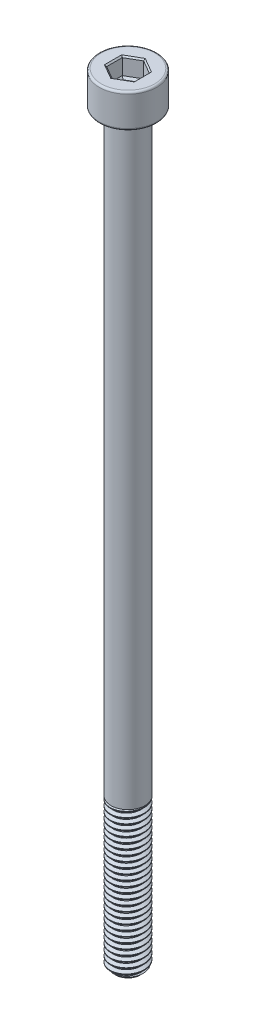
from build123d import *

# Parameters (mm, degrees)
SKETCH1_R           = 2.5
BOSS_EXTRUDE1_DEPTH = 22
THREAD1_PITCH       = 0.8
SKETCH2_R           = 2.5
BOSS_EXTRUDE2_DEPTH = 88
SKETCH3_R           = 4.25
BOSS_EXTRUDE3_DEPTH = 5
FILLET1_R           = 0.3
CUT_EXTRUDE1_DEPTH  = 2.5
CHAMFER1_SIZE       = 0.2
CUT_EXTRUDE2_DEPTH  = 0.3
CUT_EXTRUDE2_DRAFT  = -45


with BuildPart() as part:
    # Sketch1 → Boss-Extrude1 (new body)
    with BuildSketch(Plane(origin=(0, 0, 0), x_dir=(1, 0, 0), z_dir=(0, 1, 0))):
        with Locations(Location((0, 0, 0), (0, 0, 270))):
            Circle(SKETCH1_R)
    extrude(amount=BOSS_EXTRUDE1_DEPTH)

    # Thread1: arcs per turn and ends read off the stored shape
    # Thread1: the profile of Thread Profile1 profile screwed along a right-hand helix through 30 turns, 8 arcs to a turn; built about Z, then put on its axis
    thread1_z = Axis((0, 0, 0), (0, 0, 1))
    thread1_corners = [(2.5003, 0, -0.000173205), (2.5003, 0, 0.700173203), (2.0669873, 0, 0.449999999), (2.0669873, 0, 0.249999999)]
    with BuildLine(mode=Mode.PRIVATE) as thread1_profile:
        Line(thread1_corners[0], thread1_corners[1])
        Line(thread1_corners[1], thread1_corners[2])
        Line(thread1_corners[2], thread1_corners[3])
        Line(thread1_corners[3], thread1_corners[0])
    thread1_cap = Face(thread1_profile.wire())
    thread1_turn_angles = [0, 22.5, 45, 67.5, 90, 112.5, 135, 157.5, 180, 202.5, 225, 247.5, 270, 292.5, 315, 337.5, 360]
    thread1_turn_weights = [1, 0.9238795325112867, 1, 0.9238795325112867, 1, 0.9238795325112867, 1, 0.9238795325112867, 1, 0.9238795325112867, 1, 0.9238795325112867, 1, 0.9238795325112867, 1, 0.9238795325112867, 1]
    thread1_turn_rails = [Edge.make_bspline([Vector(p[0], p[1], 0).rotate(thread1_z, thread1_turn_angles[k]) / thread1_turn_weights[k] + Vector(0, 0, p[2] + THREAD1_PITCH * thread1_turn_angles[k] / 360) for k in range(17)], [0, 0, 0, 1, 1, 2, 2, 3, 3, 4, 4, 5, 5, 6, 6, 7, 7, 8, 8, 8], 2, thread1_turn_weights) for p in thread1_corners]
    thread1_turn_sides = [Face.make_surface_from_curves(thread1_turn_rails[p[0]], thread1_turn_rails[p[1]]) for p in [(0, 1), (1, 2), (2, 3), (3, 0)]]
    thread1 = Plane(origin=(0, 23, 0), x_dir=(-1, 0, 0), z_dir=(0, -1, 0)) * Solid(Shell([*[p.moved(Location((0, 0, THREAD1_PITCH * i))) for i in range(30) for p in thread1_turn_sides], thread1_cap, thread1_cap.rotate(thread1_z, 10800).moved(Location((0, 0, THREAD1_PITCH * 10800 / 360)))]))
    add(thread1, mode=Mode.SUBTRACT)

    # Sketch2 → Boss-Extrude2 (add)
    with BuildSketch(Plane(origin=(0, 22, 0), x_dir=(1, 0, 0), z_dir=(0, 1, 0))):
        with Locations(Location((0, 0, 0), (0, 0, 90))):
            Circle(SKETCH2_R)
    extrude(amount=BOSS_EXTRUDE2_DEPTH)

    # Sketch3 → Boss-Extrude3 (add)
    with BuildSketch(Plane(origin=(0, 110, 0), x_dir=(1, 0, 0), z_dir=(0, 1, 0))):
        with Locations(Location((0, 0, 0), (0, 0, 270))):
            Circle(SKETCH3_R)
    extrude(amount=BOSS_EXTRUDE3_DEPTH)

    # Fillet1
    fillet1_edges = [part.edges().sort_by_distance(p)[0] for p in [
        (0, 110, -4.25),
        (0, 115, -4.25),
    ]]
    fillet(fillet1_edges, radius=FILLET1_R)

    # Sketch4 → Cut-Revolve1 (revolve, cut)
    with BuildSketch(Plane.XY, mode=Mode.PRIVATE) as cut_revolve1_sk:
        Polygon((2.51, 0), (2.51, 0.7), (1.81, 0), align=None)
    revolve(cut_revolve1_sk.sketch.rotate(Axis((0, 0, 0), (0, 1, 0)), 90), axis=Axis((0, 0, 0), (0, 1, 0)), mode=Mode.SUBTRACT)

    # Sketch5 → Cut-Extrude1 (cut)
    with BuildSketch(Plane(origin=(0, 115, 0), x_dir=(1, 0, 0), z_dir=(0, 1, 0))):
        Polygon((0, 2.309401077), (-2, 1.154700538), (-2, -1.154700538), (0, -2.309401077), (2, -1.154700538), (2, 1.154700538), align=None)
    extrude(amount=-CUT_EXTRUDE1_DEPTH, mode=Mode.SUBTRACT)

    # Chamfer1
    chamfer1_edges = [part.edges().sort_by_distance(p)[0] for p in [
        (1, 115, -1.732050808),
        (-1, 115, -1.732050808),
        (-2, 115, 0),
        (-1, 115, 1.732050808),
        (1, 115, 1.732050808),
        (2, 115, 0),
    ]]
    chamfer(chamfer1_edges, length=CHAMFER1_SIZE)


with BuildPart() as cut_extrude2_tool:
    # Sketch6 → Cut-Extrude2 (with draft: the straight prism first)
    with BuildSketch(Plane(origin=(0, 112.5, 0), x_dir=(1, 0, 0), z_dir=(0, 1, 0))):
        Polygon((0, 2.309401077), (-2, 1.154700538), (-2, -1.154700538), (0, -2.309401077), (2, -1.154700538), (2, 1.154700538), align=None)
    extrude(amount=-CUT_EXTRUDE2_DEPTH)
    # Cut-Extrude2: the draft: its side faces are tilted about the plane it starts from
    cut_extrude2_sides = [cut_extrude2_tool.faces().sort_by_distance(p)[0] for p in [
        (-1, 112.35, -1.732050808),
        (-2, 112.35, 0),
        (-1, 112.35, 1.732050808),
        (1, 112.35, 1.732050808),
        (2, 112.35, 0),
        (1, 112.35, -1.732050808),
    ]]
    draft(cut_extrude2_sides, Plane(origin=(0, 112.5, 0), x_dir=(1, 0, 0), z_dir=(0, 1, 0)), CUT_EXTRUDE2_DRAFT)


with BuildPart() as part_1:
    add(part.part)

    # Cut-Extrude2: cut by cut_extrude2_tool
    add(cut_extrude2_tool.part, mode=Mode.SUBTRACT)


solid = part_1.part
